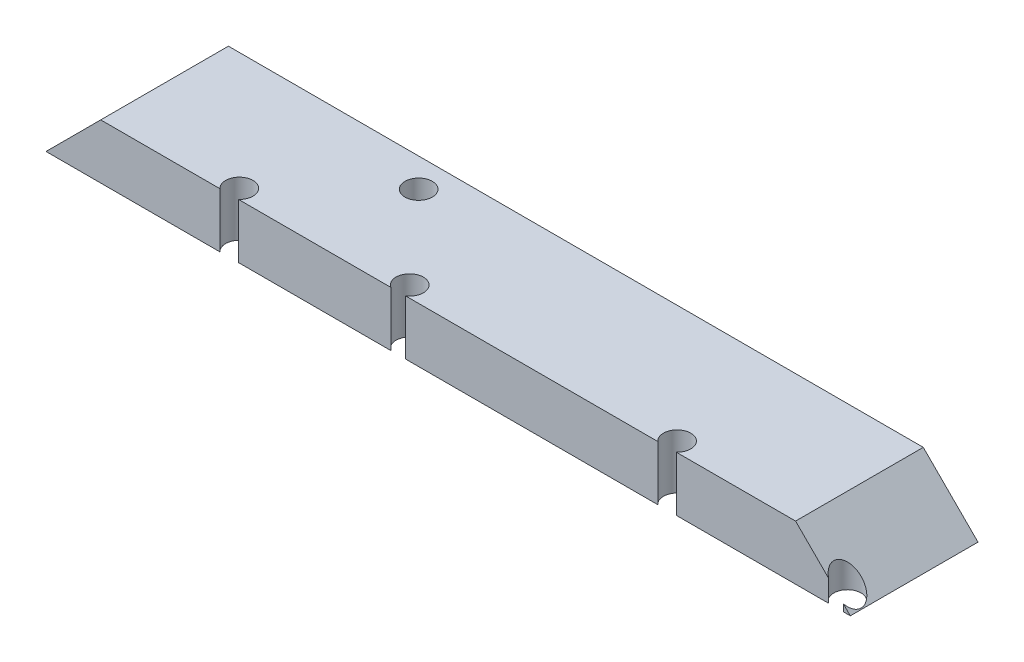
from build123d import *

# Parameters (mm, degrees)
SKETCH1_W                   = 560
SKETCH1_H                   = 88.9
BODY_DEPTH                  = 38.1
MOUNTING_HOLE_SPACING_REACH = 570.291
SKETCH2_R                   = 9.525
CUT_EXTRUDE1_REACH          = 570.291


with BuildPart() as part:
    # Sketch1 → Body (new body)
    with BuildSketch(Plane(origin=(0, 0, 0), x_dir=(1, 0, 0), z_dir=(0, 1, 0))):
        with Locations((280, 44.45)):
            Rectangle(SKETCH1_W, SKETCH1_H)
    extrude(amount=BODY_DEPTH)

    # Sketch2 → Mounting hole spacing (cut, up to next)
    with BuildSketch(Plane(origin=(0, 38.1, 0), x_dir=(1, 0, 0), z_dir=(0, 1, 0)), mode=Mode.PRIVATE) as mounting_hole_spacing_sk1:
        with Locations((127.6, 7)):
            Circle(SKETCH2_R)
    mounting_hole_spacing_tool1 = extrude(mounting_hole_spacing_sk1.sketch, amount=-MOUNTING_HOLE_SPACING_REACH, mode=Mode.PRIVATE) & part.part
    # Sketch2 → Mounting hole spacing (cut, up to next)
    with BuildSketch(Plane(origin=(0, 38.1, 0), x_dir=(1, 0, 0), z_dir=(0, 1, 0)), mode=Mode.PRIVATE) as mounting_hole_spacing_sk2:
        with Locations((190.57, 68.87)):
            Circle(SKETCH2_R)
    mounting_hole_spacing_tool2 = extrude(mounting_hole_spacing_sk2.sketch, amount=-MOUNTING_HOLE_SPACING_REACH, mode=Mode.PRIVATE) & part.part
    # Sketch2 → Mounting hole spacing (cut, up to next)
    with BuildSketch(Plane(origin=(0, 38.1, 0), x_dir=(1, 0, 0), z_dir=(0, 1, 0)), mode=Mode.PRIVATE) as mounting_hole_spacing_sk3:
        with Locations((10, 68.87)):
            Circle(SKETCH2_R)
    mounting_hole_spacing_tool3 = extrude(mounting_hole_spacing_sk3.sketch, amount=-MOUNTING_HOLE_SPACING_REACH, mode=Mode.PRIVATE) & part.part
    # Sketch2 → Mounting hole spacing (cut, up to next)
    with BuildSketch(Plane(origin=(0, 38.1, 0), x_dir=(1, 0, 0), z_dir=(0, 1, 0)), mode=Mode.PRIVATE) as mounting_hole_spacing_sk4:
        with Locations((245.2, 8.02)):
            Circle(SKETCH2_R)
    mounting_hole_spacing_tool4 = extrude(mounting_hole_spacing_sk4.sketch, amount=-MOUNTING_HOLE_SPACING_REACH, mode=Mode.PRIVATE) & part.part
    # Sketch2 → Mounting hole spacing (cut, up to next)
    with BuildSketch(Plane(origin=(0, 38.1, 0), x_dir=(1, 0, 0), z_dir=(0, 1, 0)), mode=Mode.PRIVATE) as mounting_hole_spacing_sk5:
        with Locations((550, 8.02)):
            Circle(SKETCH2_R)
    mounting_hole_spacing_tool5 = extrude(mounting_hole_spacing_sk5.sketch, amount=-MOUNTING_HOLE_SPACING_REACH, mode=Mode.PRIVATE) & part.part
    # Sketch2 → Mounting hole spacing (cut, up to next)
    with BuildSketch(Plane(origin=(0, 38.1, 0), x_dir=(1, 0, 0), z_dir=(0, 1, 0)), mode=Mode.PRIVATE) as mounting_hole_spacing_sk6:
        with Locations((432.4, 7)):
            Circle(SKETCH2_R)
    mounting_hole_spacing_tool6 = extrude(mounting_hole_spacing_sk6.sketch, amount=-MOUNTING_HOLE_SPACING_REACH, mode=Mode.PRIVATE) & part.part
    add(mounting_hole_spacing_tool1.solids().sort_by_distance((127.6, 38.1, -7))[0], mode=Mode.SUBTRACT)
    add(mounting_hole_spacing_tool2.solids().sort_by_distance((190.57, 38.1, -68.87))[0], mode=Mode.SUBTRACT)
    add(mounting_hole_spacing_tool3.solids().sort_by_distance((10, 38.1, -68.87))[0], mode=Mode.SUBTRACT)
    add(mounting_hole_spacing_tool4.solids().sort_by_distance((245.2, 38.1, -8.02))[0], mode=Mode.SUBTRACT)
    add(mounting_hole_spacing_tool5.solids().sort_by_distance((550, 38.1, -8.02))[0], mode=Mode.SUBTRACT)
    add(mounting_hole_spacing_tool6.solids().sort_by_distance((432.4, 38.1, -7))[0], mode=Mode.SUBTRACT)

    # Sketch3 → Cut-Extrude1 (cut, up to next)
    with BuildSketch(Plane(origin=(0, 0, -88.9), x_dir=(-1, 0, 0), z_dir=(0, 0, -1)), mode=Mode.PRIVATE) as cut_extrude1_sk1:
        Polygon((-560, 0), (-521.9, 38.1), (-560, 38.1), align=None)
    cut_extrude1_tool1 = extrude(cut_extrude1_sk1.sketch, amount=-CUT_EXTRUDE1_REACH, mode=Mode.PRIVATE) & part.part
    # Sketch3 → Cut-Extrude1 (cut, up to next)
    with BuildSketch(Plane(origin=(0, 0, -88.9), x_dir=(-1, 0, 0), z_dir=(0, 0, -1)), mode=Mode.PRIVATE) as cut_extrude1_sk2:
        Polygon((0, 38.1), (0, 0), (-38.1, 38.1), align=None)
    cut_extrude1_tool2 = extrude(cut_extrude1_sk2.sketch, amount=-CUT_EXTRUDE1_REACH, mode=Mode.PRIVATE) & part.part
    add(cut_extrude1_tool1.solids().sort_by_distance((547.3, 25.4, -88.9))[0], mode=Mode.SUBTRACT)
    add(cut_extrude1_tool2.solids().sort_by_distance((12.7, 25.4, -88.9))[0], mode=Mode.SUBTRACT)


solid = part.part
